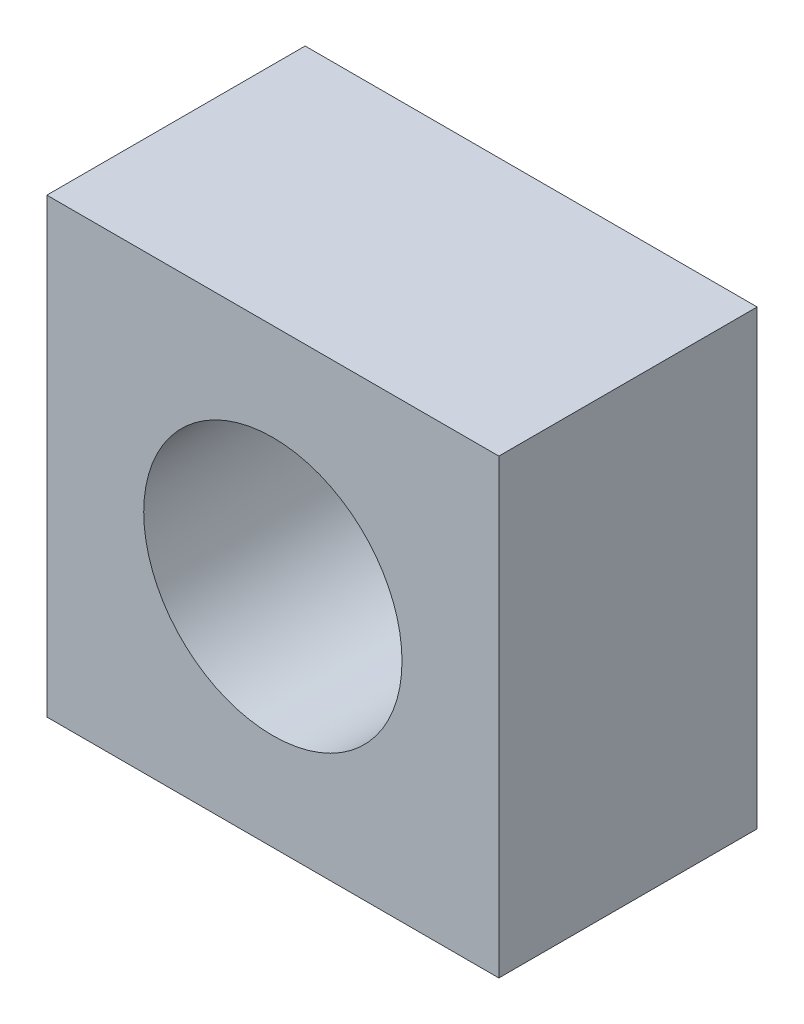
from build123d import *

# Parameters (mm, degrees)
SKETCH2_W           = 35
SKETCH2_H           = 35
SKETCH2_R           = 10
BOSS_EXTRUDE1_DEPTH = 20


with BuildPart() as part:
    # Sketch2 → Boss-Extrude1 (new body)
    with BuildSketch(Plane.XY):
        Rectangle(SKETCH2_W, SKETCH2_H)
        Circle(SKETCH2_R, mode=Mode.SUBTRACT)
    extrude(amount=BOSS_EXTRUDE1_DEPTH)


solid = part.part
